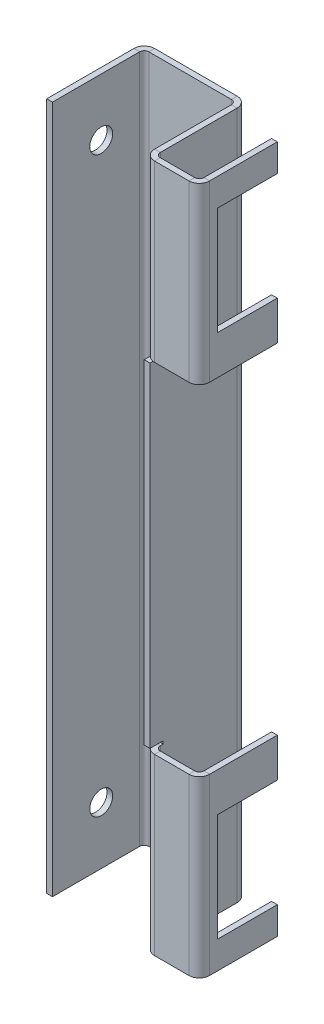
from build123d import *

# Parameters (mm, degrees)
BASE_FLANGE1_DEPTH            = 150
CUT_EXTRUDE1_REACH            = 154.095
SKETCH7_R                     = 2.5
EDGE_FLANGE1_STRIP_W          = 7
EDGE_FLANGE1_STRIP_H          = 1.25
EDGE_FLANGE1_STRIP_CUT_DEPTH  = 38
EDGE_FLANGE1_RELIEF_W         = 7.625
EDGE_FLANGE1_RELIEF_H         = 0.625
EDGE_FLANGE1_RELIEF_CUT_DEPTH = 1.25
EDGE_FLANGE1_DEPTH            = 38
EDGE_FLANGE2_STRIP_W          = 7
EDGE_FLANGE2_STRIP_H          = 1.25
EDGE_FLANGE2_STRIP_CUT_DEPTH  = 38
EDGE_FLANGE2_DEPTH            = 38
SKETCH14_W                    = 13
SKETCH14_H                    = 23.5
CUT_EXTRUDE2_DEPTH            = 1.25
EDGE_FLANGE3_STRIP_W          = 7
EDGE_FLANGE3_STRIP_H          = 1.25
EDGE_FLANGE3_STRIP_CUT_DEPTH  = 38
EDGE_FLANGE3_RELIEF_W         = 7.625
EDGE_FLANGE3_RELIEF_H         = 0.625
EDGE_FLANGE3_RELIEF_CUT_DEPTH = 1.25
EDGE_FLANGE3_DEPTH            = 38
EDGE_FLANGE4_STRIP_W          = 7
EDGE_FLANGE4_STRIP_H          = 1.25
EDGE_FLANGE4_STRIP_CUT_DEPTH  = 38
EDGE_FLANGE4_DEPTH            = 38
SKETCH21_W                    = 13
SKETCH21_H                    = 23.5
CUT_EXTRUDE3_DEPTH            = 1.25


# Sheet-metal steps are written as plain solids
with BuildPart() as part:
    # Sketch2 → Base-Flange1 (new body)
    with BuildSketch(Plane(origin=(0, 0, 0), x_dir=(1, 0, 0), z_dir=(0, 1, 0))):
        with BuildLine():
            Line((-10, -10), (-10, 9))
            ThreePointArc((-10, 9), (-9.707106781, 9.707106781), (-9, 10))
            Line((-9, 10), (9, 10))
            ThreePointArc((9, 10), (9.707106781, 9.707106781), (10, 9))
            Line((10, 9), (10, -10))
            Line((10, -10), (11.25, -10))
            Line((11.25, -10), (11.25, 9))
            ThreePointArc((11.25, 9), (10.590990258, 10.590990258), (9, 11.25))
            Line((9, 11.25), (-9, 11.25))
            ThreePointArc((-9, 11.25), (-10.590990258, 10.590990258), (-11.25, 9))
            Line((-11.25, 9), (-11.25, -10))
            Line((-11.25, -10), (-10, -10))
        make_face()
    extrude(amount=BASE_FLANGE1_DEPTH)

    # Cut-Extrude1: up to this face of the body (flat: up to its plane)
    cut_extrude1_end = Plane(part.part.faces().sort_by_distance((11.25, 75, 0.5))[0])
    # Sketch7 → Cut-Extrude1 (cut, up to the picked face)
    with BuildSketch(Plane.ZY.offset(11.25), mode=Mode.PRIVATE) as cut_extrude1_sk1:
        with Locations((-0.625, 12.5)):
            Circle(SKETCH7_R)
    cut_extrude1_tool1 = split(extrude(cut_extrude1_sk1.sketch, amount=-CUT_EXTRUDE1_REACH, mode=Mode.PRIVATE), bisect_by=cut_extrude1_end, keep=Keep.BOTH, mode=Mode.PRIVATE)
    # Sketch7 → Cut-Extrude1 (cut, up to the picked face)
    with BuildSketch(Plane.ZY.offset(11.25), mode=Mode.PRIVATE) as cut_extrude1_sk2:
        with Locations((-0.625, 137.5)):
            Circle(SKETCH7_R)
    cut_extrude1_tool2 = split(extrude(cut_extrude1_sk2.sketch, amount=-CUT_EXTRUDE1_REACH, mode=Mode.PRIVATE), bisect_by=cut_extrude1_end, keep=Keep.BOTH, mode=Mode.PRIVATE)
    add(cut_extrude1_tool1.solids().sort_by(Axis((-11.25, 12.5, -0.625), (1, 0, 0)))[0], mode=Mode.SUBTRACT)
    add(cut_extrude1_tool2.solids().sort_by(Axis((-11.25, 137.5, -0.625), (1, 0, 0)))[0], mode=Mode.SUBTRACT)

    # Edge-Flange1 strip (across the edge) → Edge-Flange1 strip cut (cut)
    with BuildSketch(Plane(origin=(11.25, 38, 10), x_dir=(0, 0, -1), z_dir=(0, -1, 0))):
        with Locations((-1.25, -0.625)):
            Rectangle(EDGE_FLANGE1_STRIP_W, EDGE_FLANGE1_STRIP_H)
    extrude(amount=EDGE_FLANGE1_STRIP_CUT_DEPTH, mode=Mode.SUBTRACT)

    # Edge-Flange1 relief (on the sheet) → Edge-Flange1 relief cut (cut)
    with BuildSketch(Plane(origin=(11.25, 38, 7.75), x_dir=(0, 0, -1), z_dir=(1, 0, 0))):
        with Locations((-3.1875, 0.3125)):
            Rectangle(EDGE_FLANGE1_RELIEF_W, EDGE_FLANGE1_RELIEF_H)
    extrude(amount=-EDGE_FLANGE1_RELIEF_CUT_DEPTH, mode=Mode.SUBTRACT)

    # Edge-Flange1 section (across the edge) → Edge-Flange1 (add)
    with BuildSketch(Plane(origin=(11.25, 38, 10), x_dir=(0, 0, -1), z_dir=(0, -1, 0))):
        with BuildLine():
            Line((0, 1), (0, 10.75))
            Line((0, 10.75), (1.25, 10.75))
            Line((1.25, 10.75), (1.25, 1))
            ThreePointArc((1.25, 1), (1.542893219, 0.292893219), (2.25, 0))
            Line((2.25, 0), (2.25, -1.25))
            ThreePointArc((2.25, -1.25), (0.659009742, -0.590990258), (0, 1))
        make_face()
    extrude(amount=EDGE_FLANGE1_DEPTH)

    # Edge-Flange2 strip (across the edge) → Edge-Flange2 strip cut (cut)
    with BuildSketch(Plane(origin=(22, 38, 8.75), x_dir=(-1, 0, 0), z_dir=(0, -1, 0))):
        with Locations((-1.25, -0.625)):
            Rectangle(EDGE_FLANGE2_STRIP_W, EDGE_FLANGE2_STRIP_H)
    extrude(amount=EDGE_FLANGE2_STRIP_CUT_DEPTH, mode=Mode.SUBTRACT)

    # Edge-Flange2 section (across the edge) → Edge-Flange2 (add)
    with BuildSketch(Plane(origin=(22, 38, 8.75), x_dir=(-1, 0, 0), z_dir=(0, -1, 0))):
        with BuildLine():
            Line((0, 1), (0, 15.75))
            Line((0, 15.75), (1.25, 15.75))
            Line((1.25, 15.75), (1.25, 1))
            ThreePointArc((1.25, 1), (1.542893219, 0.292893219), (2.25, 0))
            Line((2.25, 0), (2.25, -1.25))
            ThreePointArc((2.25, -1.25), (0.659009742, -0.590990258), (0, 1))
        make_face()
    extrude(amount=EDGE_FLANGE2_DEPTH)

    # Sketch14 → Cut-Extrude2 (cut)
    with BuildSketch(Plane(origin=(22, 0, 0), x_dir=(0, 0, -1), z_dir=(1, 0, 0))):
        with Locations((0.5, 17.75)):
            Rectangle(SKETCH14_W, SKETCH14_H)
    extrude(amount=-CUT_EXTRUDE2_DEPTH, mode=Mode.SUBTRACT)

    # Edge-Flange3 strip (across the edge) → Edge-Flange3 strip cut (cut)
    with BuildSketch(Plane(origin=(11.25, 150, 10), x_dir=(0, 0, -1), z_dir=(0, -1, 0))):
        with Locations((-1.25, -0.625)):
            Rectangle(EDGE_FLANGE3_STRIP_W, EDGE_FLANGE3_STRIP_H)
    extrude(amount=EDGE_FLANGE3_STRIP_CUT_DEPTH, mode=Mode.SUBTRACT)

    # Edge-Flange3 relief (on the sheet) → Edge-Flange3 relief cut (cut)
    with BuildSketch(Plane(origin=(11.25, 150, 7.75), x_dir=(0, 0, -1), z_dir=(1, 0, 0))):
        with Locations((-3.1875, -38.3125)):
            Rectangle(EDGE_FLANGE3_RELIEF_W, EDGE_FLANGE3_RELIEF_H)
    extrude(amount=-EDGE_FLANGE3_RELIEF_CUT_DEPTH, mode=Mode.SUBTRACT)

    # Edge-Flange3 section (across the edge) → Edge-Flange3 (add)
    with BuildSketch(Plane(origin=(11.25, 150, 10), x_dir=(0, 0, -1), z_dir=(0, -1, 0))):
        with BuildLine():
            Line((0, 1), (0, 10.75))
            Line((0, 10.75), (1.25, 10.75))
            Line((1.25, 10.75), (1.25, 1))
            ThreePointArc((1.25, 1), (1.542893219, 0.292893219), (2.25, 0))
            Line((2.25, 0), (2.25, -1.25))
            ThreePointArc((2.25, -1.25), (0.659009742, -0.590990258), (0, 1))
        make_face()
    extrude(amount=EDGE_FLANGE3_DEPTH)

    # Edge-Flange4 strip (across the edge) → Edge-Flange4 strip cut (cut)
    with BuildSketch(Plane(origin=(22, 150, 8.75), x_dir=(-1, 0, 0), z_dir=(0, -1, 0))):
        with Locations((-1.25, -0.625)):
            Rectangle(EDGE_FLANGE4_STRIP_W, EDGE_FLANGE4_STRIP_H)
    extrude(amount=EDGE_FLANGE4_STRIP_CUT_DEPTH, mode=Mode.SUBTRACT)

    # Edge-Flange4 section (across the edge) → Edge-Flange4 (add)
    with BuildSketch(Plane(origin=(22, 150, 8.75), x_dir=(-1, 0, 0), z_dir=(0, -1, 0))):
        with BuildLine():
            Line((0, 1), (0, 15.75))
            Line((0, 15.75), (1.25, 15.75))
            Line((1.25, 15.75), (1.25, 1))
            ThreePointArc((1.25, 1), (1.542893219, 0.292893219), (2.25, 0))
            Line((2.25, 0), (2.25, -1.25))
            ThreePointArc((2.25, -1.25), (0.659009742, -0.590990258), (0, 1))
        make_face()
    extrude(amount=EDGE_FLANGE4_DEPTH)

    # Sketch21 → Cut-Extrude3 (cut)
    with BuildSketch(Plane(origin=(22, 0, 0), x_dir=(0, 0, -1), z_dir=(1, 0, 0))):
        with Locations((0.5, 132.25)):
            Rectangle(SKETCH21_W, SKETCH21_H)
    extrude(amount=-CUT_EXTRUDE3_DEPTH, mode=Mode.SUBTRACT)


solid = part.part
